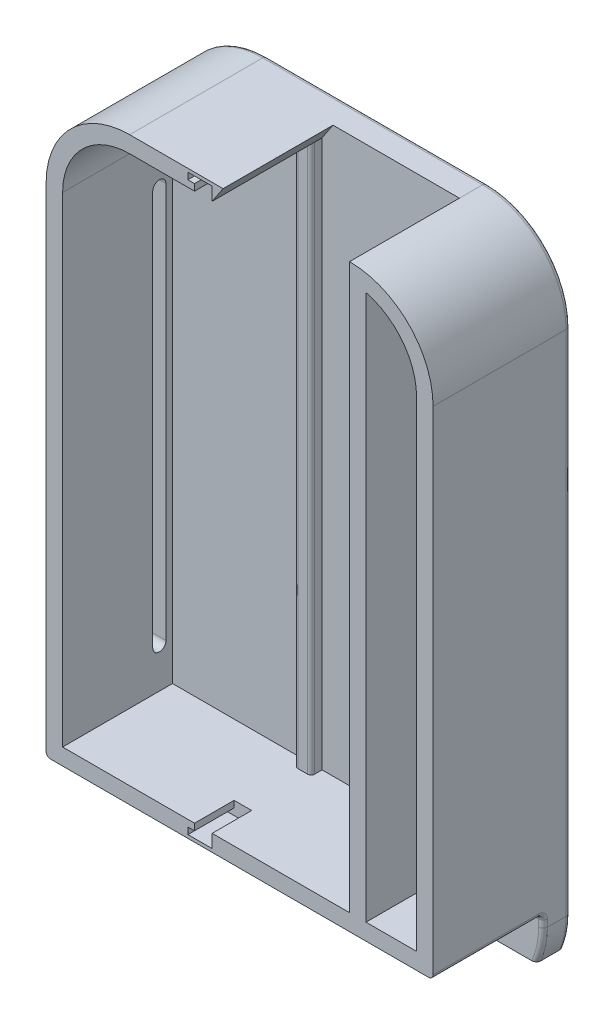
from build123d import *

# Parameters (mm, degrees)
EXTRUDE_1_DEPTH                  = 5
EXTRUDE_2_DEPTH                  = 50
CUT_EXTRUDE_1_REACH              = 297.296
SKETCH_7_W                       = 57.5
SKETCH_7_H                       = 50
SKETCH_13_W                      = 7.5
SKETCH_13_H                      = 50
EXTRUDE_5_DEPTH                  = 238.95
EXTRUDE_5_DIRECTION_2_REACH      = 287.956
EXTRUDE_5_DIRECTION_2_END_RADIUS = 30.50000001
CUT_EXTRUDE_2_DEPTH              = 18
SKETCH_17_W                      = 7.5
SKETCH_17_H                      = 248.950000021
EXTRUDE_6_DEPTH                  = 5
CUT_EXTRUDE_3_DEPTH              = 239.676338417
EXTRUDE_START                    = 7.5
EXTRUDE_7_DEPTH                  = 7.5
SKETCH_25_R                      = 10.5
CUT_EXTRUDE_4_DEPTH              = 7
CUT_EXTRUDE_5_DEPTH              = 7
CUT_EXTRUDE_6_DEPTH              = 50
FILLET_1_R                       = 2
FILLET_2_R                       = 1.5


with BuildPart() as part:
    # 스케치1 → 보스-돌출1 (new body)
    with BuildSketch(Plane.XY):
        with BuildLine():
            Line((-54.965833173, -124.109121223), (-84.965211596, -124.109121223))
            ThreePointArc((-84.965211596, -124.109121223), (-87.208123505, -116.859619255), (-87.965833184, -109.309002813))
            Line((-87.965833184, -109.309002813), (-87.965833184, 121.840997436))
            ThreePointArc((-87.965833184, 121.840997436), (-76.835890921, 148.711055023), (-49.96583338, 159.840997395))
            Line((-49.96583338, 159.840997395), (50.034166942, 159.840997395))
            ThreePointArc((50.034166942, 159.840997395), (76.904224486, 148.711055107), (88.034166835, 121.840997589))
            Line((88.034166835, 121.840997589), (88.034166835, -109.309002665))
            ThreePointArc((88.034166835, -109.309002665), (87.276457448, -116.859617815), (85.033546335, -124.109118652))
            Line((85.033546335, -124.109118652), (55.034166826, -124.109118652))
            add(Edge.make_bspline(
                [(55.034166826, -124.109118652), (55.034282764, -114.109081463), (45.035387931, -114.109002625)],
                knots=[2.034478031, 2.034478031, 2.034478031, 3.60512577, 3.60512577, 3.60512577], degree=2, weights=[1, 0.707159313, 1]))
            Line((45.035387931, -114.109002625), (-44.967051758, -114.109002625))
            add(Edge.make_bspline(
                [(-44.967051758, -114.109002625), (-54.965951682, -114.109078942), (-54.965833173, -124.109121223)],
                knots=[5.819651939, 5.819651939, 5.819651939, 7.390300187, 7.390300187, 7.390300187], degree=2, weights=[1, 0.707159133, 1]))
        make_face()
    extrude(amount=EXTRUDE_1_DEPTH)

    # 스케치2 → 보스-돌출2 (add)
    with BuildSketch(Plane.XY.offset(5)):
        with BuildLine():
            Line((-87.965833184, 121.840997437), (-87.965833184, -104.109002625))
            Line((-87.965833183, -104.109002625), (-80.465833183, -104.109002625))
            Line((-80.465833183, -104.109002625), (80.534166835, -104.109002625))
            Line((80.534166835, -104.109002625), (88.034166835, -104.109002625))
            Line((88.034166835, -104.109002625), (88.034166837, 121.84099759))
            ThreePointArc((88.034166837, 121.84099759), (76.904224488, 148.711055109), (50.034166943, 159.840997396))
            Line((50.034166943, 159.840997396), (-49.965833379, 159.840997396))
            ThreePointArc((-49.965833379, 159.840997396), (-76.835890921, 148.711055024), (-87.965833184, 121.840997437))
        make_face()
        with BuildLine():
            ThreePointArc((50.03416692, 152.340997396), (71.600923619, 143.407754258), (80.534166835, 121.84099759))
            Line((80.534166835, 121.84099759), (80.534166835, -96.609002625))
            Line((80.534166835, -96.609002625), (-80.465833183, -96.609002625))
            Line((-80.465833183, -96.609002625), (-80.465833184, 121.840997427))
            ThreePointArc((-80.465833184, 121.840997427), (-71.532590065, 143.407754162), (-49.965833379, 152.340997396))
            Line((-49.965833379, 152.340997396), (50.03416692, 152.340997396))
        make_face(mode=Mode.SUBTRACT)
    extrude(amount=EXTRUDE_2_DEPTH)

    # 스케치7 → 컷-돌출1 (cut, up to next)
    with BuildSketch(Plane.XZ.offset(-152.340997396), mode=Mode.PRIVATE) as cut_extrude_1_sk1:
        with Locations((21.28416692, 30)):
            Rectangle(SKETCH_7_W, SKETCH_7_H)
    cut_extrude_1_tool1 = extrude(cut_extrude_1_sk1.sketch, amount=-CUT_EXTRUDE_1_REACH, mode=Mode.PRIVATE) & part.part
    add(cut_extrude_1_tool1.solids().sort_by_distance((21.284167, 152.340997, 30))[0], mode=Mode.SUBTRACT)

    # 스케치13 → 보스-돌출5 (add)
    with BuildSketch(Plane(origin=(0, 142.340997396, 0), x_dir=(-1, 0, 0), z_dir=(0, -1, 0))):
        with Locations((-53.78416692, -30)):
            Rectangle(SKETCH_13_W, SKETCH_13_H)
    extrude(amount=EXTRUDE_5_DEPTH)

    # 보스-돌출5 direction 2: up to this cylinder (the profile starts inside it)
    extrude_5_direction_2_end = Plane(origin=(50.034166826, 121.840997386, 30), z_dir=(0, 0, -1)) * Cylinder(EXTRUDE_5_DIRECTION_2_END_RADIUS, 637.91200002, mode=Mode.PRIVATE)
    # 스케치13 → 보스-돌출5 direction 2 (add, up to the surface)
    with BuildSketch(Plane(origin=(0, 142.340997396, 0), x_dir=(-1, 0, 0), z_dir=(0, -1, 0)), mode=Mode.PRIVATE) as extrude_5_direction_2_sk1:
        with Locations((-53.78416692, -30)):
            Rectangle(SKETCH_13_W, SKETCH_13_H)
    extrude_5_direction_2_tool1 = extrude(extrude_5_direction_2_sk1.sketch, amount=-EXTRUDE_5_DIRECTION_2_REACH, mode=Mode.PRIVATE) & extrude_5_direction_2_end
    add(extrude_5_direction_2_tool1.solids().sort_by_distance((53.784167, 142.340997, 30))[0])

    # 스케치15 → 컷-돌출2 (cut)
    with BuildSketch(Plane.XY.offset(55)):
        Polygon((-20.46583308, 152.340997396), (-20.46583308, 155.340997396), (-23.46583308, 155.340997396), (-23.46583308, 158.340997396), (-12.46583308, 158.340997396), (-12.46583308, 155.340997396), (-12.46583308, 152.340997396), align=None)
        Polygon((-23.46583308, -102.609002625), (-23.46583308, -99.609002625), (-20.46583308, -99.609002625), (-20.46583308, -96.609002625), (-12.46583308, -96.609002625), (-12.46583308, -99.609002625), (-12.46583308, -102.609002625), align=None)
    extrude(amount=-CUT_EXTRUDE_2_DEPTH, mode=Mode.SUBTRACT)

    # 스케치17 → 보스-돌출6 (add)
    with BuildSketch(Plane.XY.offset(5)):
        with Locations((-16.215833058, 27.865997386)):
            Rectangle(SKETCH_17_W, SKETCH_17_H)
    extrude(amount=EXTRUDE_6_DEPTH)

    # 스케치22 → 컷-돌출3 (cut, through all)
    with BuildSketch(Plane(origin=(-80.465833183, 0, 0), x_dir=(0, 0, -1), z_dir=(1.0, 5.158572888602019e-12, 0))):
        with BuildLine():
            Line((-8, 101.840997437), (-8, -78.159002563))
            ThreePointArc((-8, -78.159002563), (-11, -81.159002563), (-14, -78.159002563))
            Line((-14, -78.159002563), (-14, 101.840997437))
            ThreePointArc((-14, 101.840997437), (-11, 104.840997437), (-8, 101.840997437))
        make_face()
    extrude(amount=-CUT_EXTRUDE_3_DEPTH, mode=Mode.SUBTRACT)

    # 스케치24 → 보스-돌출7 (add)
    with BuildSketch(Plane(origin=(0, 0, 0), x_dir=(-1, 0, 0), z_dir=(0, 0, -1)).offset(EXTRUDE_START)):
        with BuildLine():
            Line((-85.033546335, -124.109118652), (-55.034166826, -124.109118652))
            add(Edge.make_bspline(
                [(-45.035387931, -114.109002625), (-55.034282764, -114.109081463), (-55.034166826, -124.109118652)],
                knots=[5.819652191, 5.819652191, 5.819652191, 7.39029993, 7.39029993, 7.39029993], degree=2, weights=[1, 0.707159313, 1]))
            Line((-45.035387931, -114.109002625), (44.967051758, -114.109002625))
            add(Edge.make_bspline(
                [(54.965833173, -124.109121223), (54.965951682, -114.109078942), (44.967051758, -114.109002625)],
                knots=[5.176070427, 5.176070427, 5.176070427, 6.746718676, 6.746718676, 6.746718676], degree=2, weights=[1, 0.707159133, 1]))
            Line((54.965833173, -124.109121223), (84.965211596, -124.109121223))
            ThreePointArc((84.965211596, -124.109121223), (87.208123505, -116.859619255), (87.965833184, -109.309002813))
            Line((87.965833184, -109.309002813), (87.965833184, 121.840997436))
            ThreePointArc((87.965833184, 121.840997436), (76.835890921, 148.711055023), (49.96583338, 159.840997395))
            Line((49.96583338, 159.840997395), (-50.034166942, 159.840997395))
            ThreePointArc((-50.034166942, 159.840997395), (-76.904224486, 148.711055107), (-88.034166835, 121.840997589))
            Line((-88.034166835, 121.840997589), (-88.034166835, -109.309002665))
            ThreePointArc((-88.034166835, -109.309002665), (-87.276457448, -116.859617815), (-85.033546335, -124.109118652))
        make_face()
    extrude(amount=-EXTRUDE_7_DEPTH)

    # 스케치25 → 컷-돌출4 (cut)
    with BuildSketch(Plane(origin=(0, 0, -7.5), x_dir=(-1, 0, 0), z_dir=(0, 0, -1))):
        with Locations((-71.0209713, -47.709002614)):
            Circle(SKETCH_25_R)
        with Locations((71.3790287, -47.709002614)):
            Circle(SKETCH_25_R)
        with Locations((74.165833174, -79.502382618)):
            Circle(SKETCH_25_R)
        with Locations((-74.234166826, -79.502382618)):
            Circle(SKETCH_25_R)
    extrude(amount=-CUT_EXTRUDE_4_DEPTH, mode=Mode.SUBTRACT)

    # 스케치27 → 컷-돌출5 (cut)
    with BuildSketch(Plane(origin=(0, 0, -7.5), x_dir=(-1, 0, 0), z_dir=(0, 0, -1))):
        with BuildLine():
            Line((-40.034166942, 150.840997395), (39.965833175, 150.840997395))
            ThreePointArc((39.965833175, 150.840997395), (47.465833175, 143.340997395), (39.965833175, 135.840997395))
            Line((39.965833175, 135.840997395), (-40.034166942, 135.840997395))
            ThreePointArc((-40.034166942, 135.840997395), (-47.534166942, 143.340997395), (-40.034166942, 150.840997395))
        make_face()
    extrude(amount=-CUT_EXTRUDE_5_DEPTH, mode=Mode.SUBTRACT)

    # 스케치29 → 컷-돌출6 (cut)
    with BuildSketch(Plane.XY.offset(55)):
        Polygon((-7.46583308, 159.840997395), (-12.465833058, 152.340997396), (-7.46583308, 152.340997396), align=None)
    extrude(amount=-CUT_EXTRUDE_6_DEPTH, mode=Mode.SUBTRACT)

    # 필렛1
    fillet_1_edges = [part.edges().sort_by_distance(p)[0] for p in [
        (0.034166826, -104.109002625, 5),
    ]]
    fillet(fillet_1_edges, radius=FILLET_1_R)
    fillet_1_2_edges = [part.edges().sort_by_distance(p)[0] for p in [
        (76.904224486, 148.711055107, -7.5),
        (88.034166835, 6.265997462, -7.5),
        (87.276457448, -116.859617815, -7.5),
        (70.03385658, -124.109118652, -7.5),
        (52.105730433, -117.037911326, -7.5),
        (0.034168086, -114.109002625, -7.5),
        (-52.037396798, -117.037911343, -7.5),
        (-69.965522385, -124.109121223, -7.5),
        (-87.208123505, -116.859619255, -7.5),
        (-87.965833184, 6.265997311, -7.5),
        (-76.835890921, 148.711055023, -7.5),
        (0.034166781, 159.840997395, -7.5),
    ]]
    fillet(fillet_1_2_edges, radius=FILLET_1_R - 0.0001)  # a hair under: the kernel refuses the full size
    fillet_1_3_edges = [part.edges().sort_by_distance(p)[0] for p in [
        (-87.208123505, -116.859619255, 5),
        (-87.965833184, -107.709002719, 5),
        (-87.965833183, -104.109002625, 31),
        (88.034166835, -104.109002625, 31),
        (87.276457448, -116.859617815, 5),
        (88.034166835, -107.709002645, 5),
        (88.034166835, -104.694789063, 5.585786438),
        (-87.965833184, -104.694789063, 5.585786438),
    ]]
    fillet(fillet_1_3_edges, radius=FILLET_1_R)

    # 필렛2
    fillet_2_edges = [part.edges().sort_by_distance(p)[0] for p in [
        (-12.465833058, 27.865997386, 10),
        (-19.965833058, 27.865997386, 10),
    ]]
    fillet(fillet_2_edges, radius=FILLET_2_R)


solid = part.part
